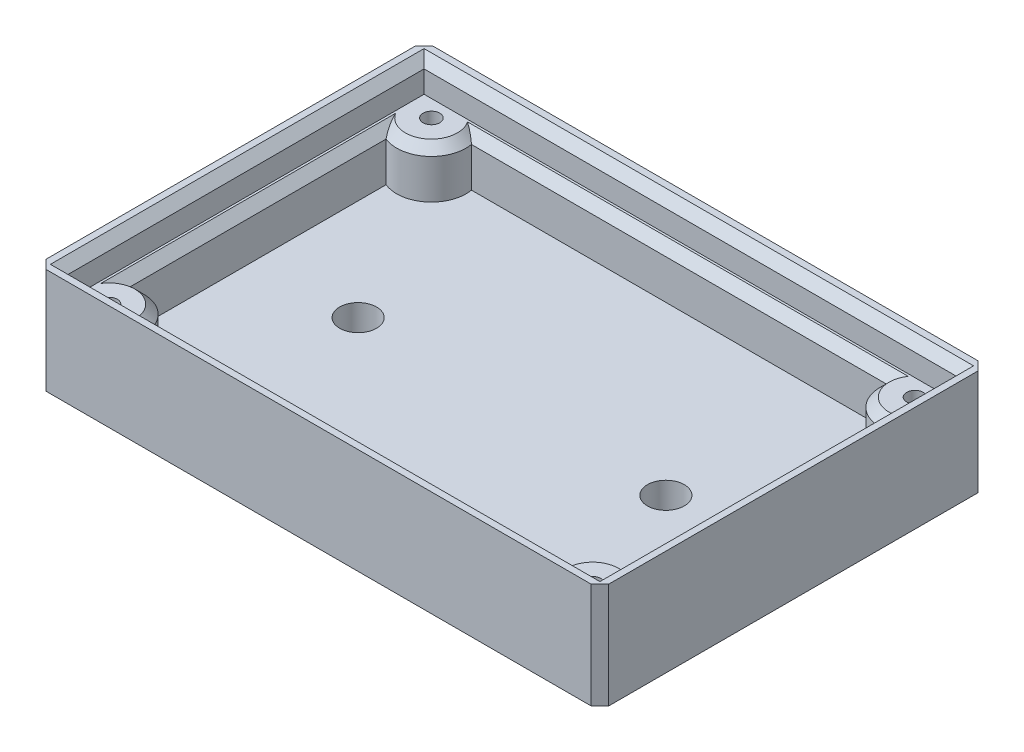
from build123d import *

# Parameters (mm, degrees)
SKETCH1_W           = 64
SKETCH1_H           = 44
BOSS_EXTRUDE1_DEPTH = 12
SKETCH2_W           = 60.5
SKETCH2_H           = 40.5
CUT_EXTRUDE1_DEPTH  = 3.5
SKETCH3_R           = 0.95
CUT_EXTRUDE2_DEPTH  = 6
SHELL1_START        = 3
SHELL1_DEPTH        = 5.5
CHAMFER1_SIZE       = 1
CHAMFER2_SIZE       = 1
CHAMFER3_SIZE       = 1
SKETCH4_R           = 2.1
CUT_EXTRUDE3_DEPTH  = 40.862262856


# Read off the part's stored shape, not the designer's step: Shell1
with BuildPart() as part:
    # Sketch1 → Boss-Extrude1 (new body)
    with BuildSketch(Plane(origin=(0, 0, 0), x_dir=(1, 0, 0), z_dir=(0, 1, 0))):
        Rectangle(SKETCH1_W, SKETCH1_H)
    extrude(amount=BOSS_EXTRUDE1_DEPTH)

    # Sketch2 → Cut-Extrude1 (cut)
    with BuildSketch(Plane(origin=(0, 12, 0), x_dir=(1, 0, 0), z_dir=(0, 1, 0))):
        Rectangle(SKETCH2_W, SKETCH2_H)
    extrude(amount=-CUT_EXTRUDE1_DEPTH, mode=Mode.SUBTRACT)

    # Sketch3 → Cut-Extrude2 (cut)
    with BuildSketch(Plane(origin=(0, 8.5, 0), x_dir=(1, 0, 0), z_dir=(0, 1, 0))):
        with Locations(Location((-27.5, 18.333333333, 0), (0, 0, 270))):
            Circle(SKETCH3_R)
        with Locations(Location((27.5, 18.333333333, 0), (0, 0, 270))):
            Circle(SKETCH3_R)
        with Locations(Location((27.5, -18.333333333, 0), (0, 0, 270))):
            Circle(SKETCH3_R)
        with Locations(Location((-27.5, -18.333333333, 0), (0, 0, 270))):
            Circle(SKETCH3_R)
    extrude(amount=-CUT_EXTRUDE2_DEPTH, mode=Mode.SUBTRACT)

    # Shell1 outline → Shell1 (cut)
    with BuildSketch(Plane(origin=(0, 0, 0), x_dir=(1, 0, 0), z_dir=(0, 1, 0)).offset(SHELL1_START)):
        with BuildLine():
            Line((-23.60666524, -19), (23.60666524, -19))
            ThreePointArc((23.60666524, -19), (25.030327008, -15.250604784), (29, -14.679226055))
            Line((29, -14.679226055), (29, 14.679226055))
            ThreePointArc((29, 14.679226055), (25.030327008, 15.250604784), (23.60666524, 19))
            Line((23.60666524, 19), (-23.60666524, 19))
            ThreePointArc((-23.60666524, 19), (-25.030327008, 15.250604784), (-29, 14.679226055))
            Line((-29, 14.679226055), (-29, -14.679226055))
            ThreePointArc((-29, -14.679226055), (-25.030327008, -15.250604784), (-23.60666524, -19))
        make_face()
    extrude(amount=SHELL1_DEPTH, mode=Mode.SUBTRACT)

    # Chamfer1
    chamfer1_edges = [part.edges().sort_by_distance(p)[0] for p in [
        (30.25, 12, 0),
        (0, 12, -20.25),
        (-30.25, 12, 0),
        (0, 12, 20.25),
    ]]
    chamfer(chamfer1_edges, length=CHAMFER1_SIZE)

    # Chamfer2
    chamfer2_edges = [part.edges().sort_by_distance(p)[0] for p in [
        (0, 8.5, 19),
        (29, 8.5, 0),
        (0, 8.5, -19),
        (-29, 8.5, 0),
        (-25.030327008, 8.5, -15.250604784),
        (25.030327008, 8.5, -15.250604784),
        (25.030327008, 8.5, 15.250604784),
        (-25.030327008, 8.5, 15.250604784),
    ]]
    chamfer(chamfer2_edges, length=CHAMFER2_SIZE)

    # Chamfer3
    chamfer3_edges = [part.edges().sort_by_distance(p)[0] for p in [
        (-32, 6, 22),
        (-32, 6, -22),
        (32, 6, -22),
        (32, 6, 22),
    ]]
    chamfer(chamfer3_edges, length=CHAMFER3_SIZE)

    # Sketch4 → Cut-Extrude3 (cut, through all)
    with BuildSketch(Plane(origin=(0, 3, 0), x_dir=(1, 0, 0), z_dir=(0, 1, 0))):
        with Locations(Location((-17.5, 0, 0), (0, 0, 270))):
            Circle(SKETCH4_R)
        with Locations(Location((17.5, 0, 0), (0, 0, 270))):
            Circle(SKETCH4_R)
    extrude(amount=-CUT_EXTRUDE3_DEPTH, mode=Mode.SUBTRACT)


solid = part.part
